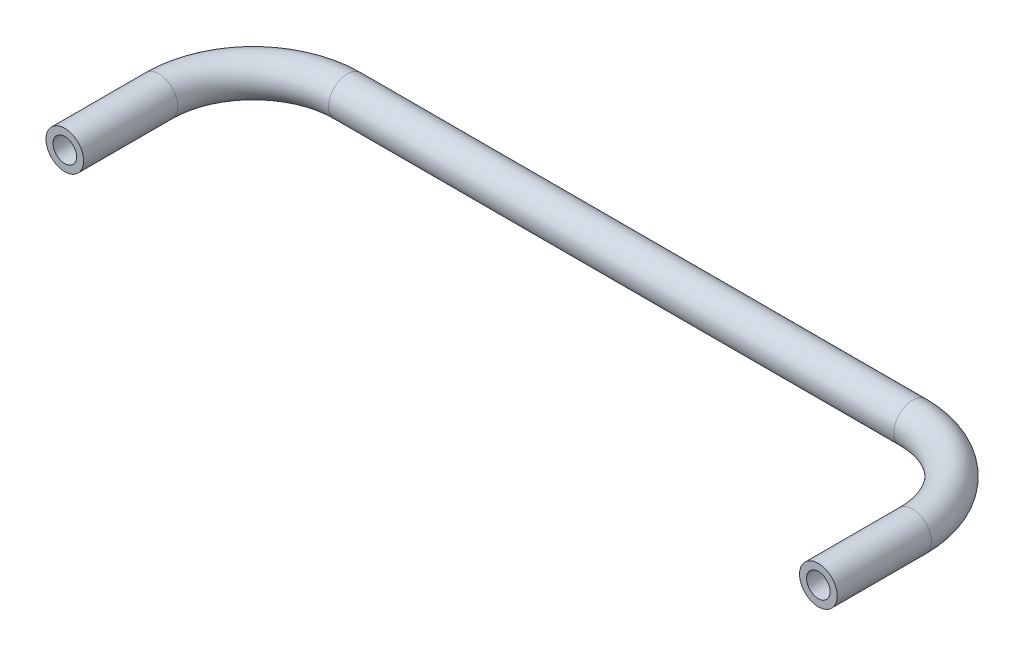
from build123d import *

# Parameters (mm, degrees)
SKETCH2_R                          = 3.81
F_3_16_0_1875_DIAMETER_HOLE1_D     = 4.7625
F_3_16_0_1875_DIAMETER_HOLE1_DEPTH = 19.05
F_3_16_0_1875_DIAMETER_HOLE1_TIP   = 1.430799349


with BuildPart() as part:
    # Sweep1: sweep along a path in Sketch1
    with BuildLine(Plane(origin=(0, 0, 0), x_dir=(1, 0, 0), z_dir=(0, 1, 0))) as sweep1_path:
        Line((76.2, -38.1), (76.2, -19.05))
        ThreePointArc((76.2, -19.05), (70.620384182, -5.579615818), (57.15, 0))
        Line((57.15, 0), (-57.15, 0))
        ThreePointArc((-57.15, 0), (-70.620384182, -5.579615818), (-76.2, -19.05))
        Line((-76.2, -19.05), (-76.2, -38.1))
    # Sketch2 → Sweep1 (sweep)
    with BuildSketch(Plane(origin=(-76.2, 0, 38.1), x_dir=(1, 0, 0), z_dir=(0, 0, 1))):
        Circle(SKETCH2_R)
    sweep(path=sweep1_path.line)

    # 3/16 (0.1875) Diameter Hole1
    with Locations(Plane.XY.offset(38.1)):
        with Locations((-76.2, 0), (76.2, 0)):
            Hole(F_3_16_0_1875_DIAMETER_HOLE1_D / 2, depth=F_3_16_0_1875_DIAMETER_HOLE1_DEPTH)
            with Locations((0, 0, -(F_3_16_0_1875_DIAMETER_HOLE1_DEPTH + F_3_16_0_1875_DIAMETER_HOLE1_TIP / 2))):  # 118° drill point
                Cone(0, F_3_16_0_1875_DIAMETER_HOLE1_D / 2, F_3_16_0_1875_DIAMETER_HOLE1_TIP, mode=Mode.SUBTRACT)


solid = part.part
